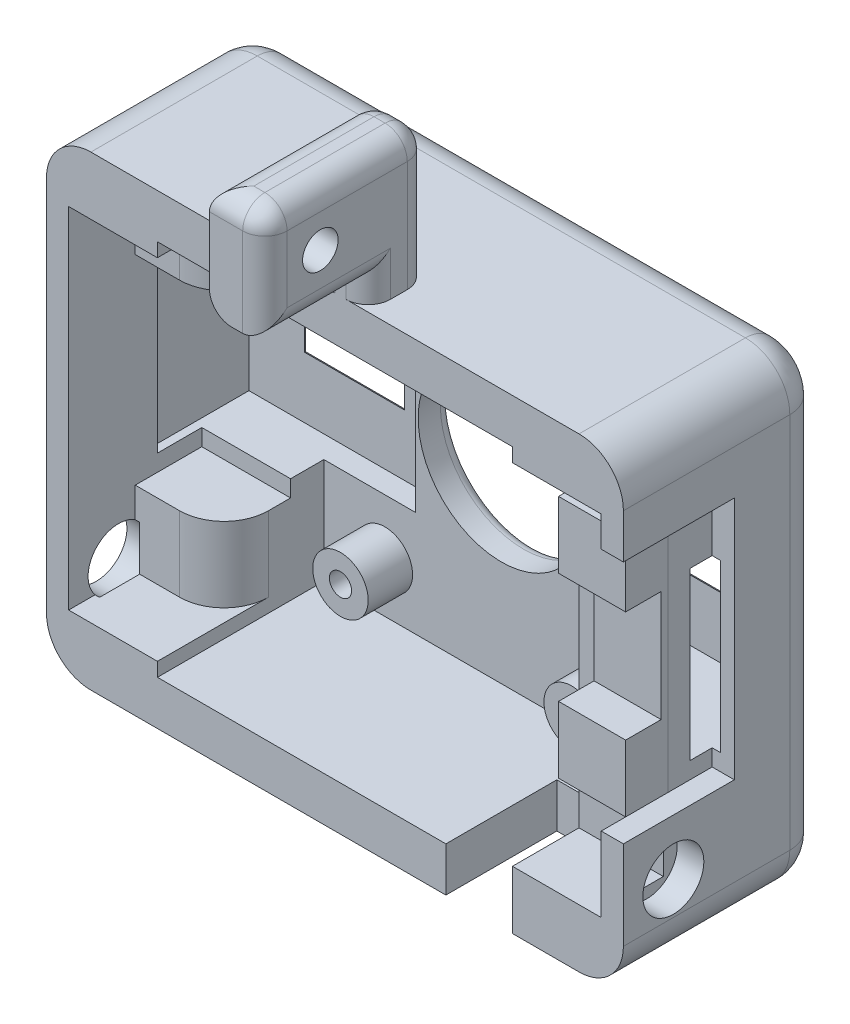
from build123d import *

# Parameters (mm, degrees)
SKETCH1_W               = 52
SKETCH1_H               = 42
BOSS_EXTRUDE1_DEPTH     = 10
SKETCH2_W               = 48
SKETCH2_H               = 31.5
CUT_EXTRUDE1_DEPTH      = 6
SKETCH6_W               = 52
SKETCH6_H               = 42
BOSS_EXTRUDE2_DEPTH     = 8
CUT_EXTRUDE5_DEPTH      = 36.510561809
CUT_EXTRUDE5_DEPTH_BACK = 9
SKETCH5_W               = 32
SKETCH5_H               = 34
CUT_EXTRUDE4_REACH      = 38.633
SKETCH7_R               = 7.5
FILLET2_R               = 1
FILLET3_R               = 3
FILLET4_R               = 4
SKETCH8_W               = 2
SKETCH8_H               = 22
CUT_EXTRUDE6_DEPTH      = 10
SKETCH11_W              = 6.046016102
SKETCH11_H              = 22
BOSS_EXTRUDE9_DEPTH     = 3.8
SKETCH12_W              = 7.5
SKETCH12_H              = 10
CUT_EXTRUDE8_DEPTH      = 3.2
FILLET9_R               = 4
SKETCH13_R              = 2.75
CUT_EXTRUDE9_DEPTH      = 2.4
CUT_EXTRUDE10_START     = -2.4
SKETCH14_R              = 2.75
CUT_EXTRUDE10_DEPTH     = 2.4
SKETCH18_W              = 17
SKETCH18_H              = 15
CUT_EXTRUDE15_DEPTH     = 9
SKETCH19_W              = 9
SKETCH19_H              = 4
CUT_EXTRUDE16_DEPTH     = 1
SKETCH21_W              = 5
SKETCH21_H              = 5.520077182
BOSS_EXTRUDE10_DEPTH    = 2
SKETCH27_W              = 5
SKETCH27_H              = 14.834345629
BOSS_EXTRUDE13_DEPTH    = 10
SKETCH28_R              = 1.6
CUT_EXTRUDE19_DEPTH     = 48.392414643
FILLET14_R              = 2
FILLET13_R              = 2
SKETCH25_R              = 2.5
BOSS_EXTRUDE12_DEPTH    = 4
SKETCH26_R              = 1
CUT_EXTRUDE18_DEPTH     = 4
SKETCH29_W              = 8
SKETCH29_H              = 18
CUT_EXTRUDE20_DEPTH     = 6
SKETCH30_W              = 28
SKETCH30_H              = 9
CUT_EXTRUDE21_DEPTH     = 2
CHAMFER1_SIZE           = 1
SKETCH31_W              = 6
SKETCH31_H              = 4
CUT_EXTRUDE22_DEPTH     = 10


with BuildPart() as part:
    # Sketch1 → Boss-Extrude1 (new body)
    with BuildSketch(Plane.XY):
        Rectangle(SKETCH1_W, SKETCH1_H)
    extrude(amount=BOSS_EXTRUDE1_DEPTH)

    # Sketch2 → Cut-Extrude1 (cut)
    with BuildSketch(Plane.XY.offset(10)):
        Rectangle(SKETCH2_W, SKETCH2_H)
    extrude(amount=-CUT_EXTRUDE1_DEPTH, mode=Mode.SUBTRACT)

    # Sketch6 → Boss-Extrude2 (add)
    with BuildSketch(Plane(origin=(0, 0, 0), x_dir=(-1, 0, 0), z_dir=(0, 0, -1))):
        Rectangle(SKETCH6_W, SKETCH6_H)
    extrude(amount=BOSS_EXTRUDE2_DEPTH)

    # Sketch5 → Cut-Extrude5 (cut, two sides: drawn at the far end of the back side and taken through both)
    with BuildSketch(Plane.XY.offset(4).offset(-CUT_EXTRUDE5_DEPTH_BACK)):
        Rectangle(SKETCH5_W, SKETCH5_H)
    extrude(amount=CUT_EXTRUDE5_DEPTH + CUT_EXTRUDE5_DEPTH_BACK, mode=Mode.SUBTRACT)

    # Sketch7 → Cut-Extrude4 (cut, up to next)
    with BuildSketch(Plane.XY.offset(-5), mode=Mode.PRIVATE) as cut_extrude4_sk1:
        Circle(SKETCH7_R)
    cut_extrude4_tool1 = extrude(cut_extrude4_sk1.sketch, amount=-CUT_EXTRUDE4_REACH, mode=Mode.PRIVATE) & part.part
    add(cut_extrude4_tool1.solids().sort_by_distance((0, 0, -5))[0], mode=Mode.SUBTRACT)

    # Fillet2
    fillet2_edges = [part.edges().sort_by_distance(p)[0] for p in [
        (-7.5, 0, -8),
    ]]
    fillet(fillet2_edges, radius=FILLET2_R)

    # Fillet3
    fillet3_edges = [part.edges().sort_by_distance(p)[0] for p in [
        (-26, 0, -8),
        (0, 21, -8),
        (26, 0, -8),
        (0, -21, -8),
    ]]
    fillet(fillet3_edges, radius=FILLET3_R)

    # Fillet4
    # the kernel refuses this fillet: 4 mm, written as the material it takes off along each edge
    with BuildSketch(Plane(origin=(22, 17, -8), x_dir=(0, 1, 0), z_dir=(-1, 0, 0))) as fillet4_piece_1:
        with BuildLine():
            CenterArc((1, -3), 3, 0, 90)
            Line((4, -3), (4, 0))
            Line((4, 0), (1, 0))
        make_face()
    revolve(axis=Axis((22, 17, -8), (0, 0, -1)), revolution_arc=90, mode=Mode.SUBTRACT)
    with BuildSketch(Plane(origin=(-22, 17, -8), x_dir=(-1, 0, 0), z_dir=(0, -1, 0))) as fillet4_piece_2:
        with BuildLine():
            CenterArc((1, -3), 3, 0, 90)
            Line((4, -3), (4, 0))
            Line((4, 0), (1, 0))
        make_face()
    revolve(axis=Axis((-22, 17, -8), (0, 0, -1)), revolution_arc=90, mode=Mode.SUBTRACT)
    with BuildSketch(Plane(origin=(22, -17, -8), x_dir=(1, 0, 0), z_dir=(0, 1, 0))) as fillet4_piece_3:
        with BuildLine():
            CenterArc((1, -3), 3, 0, 90)
            Line((4, -3), (4, 0))
            Line((4, 0), (1, 0))
        make_face()
    revolve(axis=Axis((22, -17, -8), (0, 0, -1)), revolution_arc=90, mode=Mode.SUBTRACT)
    with BuildSketch(Plane(origin=(-22, -17, -8), x_dir=(0, -1, 0), z_dir=(1, 0, 0))) as fillet4_piece_4:
        with BuildLine():
            CenterArc((1, -3), 3, 0, 90)
            Line((4, -3), (4, 0))
            Line((4, 0), (1, 0))
        make_face()
    revolve(axis=Axis((-22, -17, -8), (0, 0, -1)), revolution_arc=90, mode=Mode.SUBTRACT)
    with BuildSketch(Plane(origin=(-26, 21, -8), x_dir=(0, -1, 0), z_dir=(0, 0, 1)), Plane(origin=(26, -21, 20), x_dir=(-1, 0, 0), z_dir=(0, 0, -1))) as fillet4_piece_5:
        with BuildLine():
            CenterArc((FILLET4_R, FILLET4_R), FILLET4_R, 180, 90)
            Line((0, FILLET4_R), (0, 0))
            Line((0, 0), (FILLET4_R, 0))
        make_face()
    extrude(amount=28, mode=Mode.SUBTRACT)
    with BuildSketch(Plane(origin=(-26, -21, -8), x_dir=(0, 1, 0), z_dir=(0, 0, 1)), Plane(origin=(26, 21, 20), x_dir=(-1, 0, 0), z_dir=(0, 0, -1))) as fillet4_piece_6:
        with BuildLine():
            CenterArc((FILLET4_R, -FILLET4_R), FILLET4_R, 90, 90)
            Line((0, -FILLET4_R), (0, 0))
            Line((0, 0), (FILLET4_R, 0))
        make_face()
    extrude(amount=28, mode=Mode.SUBTRACT)

    # Sketch8 → Cut-Extrude6 (cut)
    with BuildSketch(Plane.XY.offset(10)):
        with Locations((25, 2)):
            Rectangle(SKETCH8_W, SKETCH8_H)
    extrude(amount=-CUT_EXTRUDE6_DEPTH, mode=Mode.SUBTRACT)

    # Fillet9
    fillet9_edges = [part.edges().sort_by_distance(p)[0] for p in [
        (-16, 0, 4),
    ]]
    fillet(fillet9_edges, radius=FILLET9_R)

    # Sketch13 → Cut-Extrude9 (cut)
    with BuildSketch(Plane(origin=(26, 0, 0), x_dir=(0, 0, -1), z_dir=(1, 0, 0))):
        with Locations(Location((-5.5, -14, 0), (0, 0, 90))):
            Circle(SKETCH13_R)
    extrude(amount=-CUT_EXTRUDE9_DEPTH, mode=Mode.SUBTRACT)

    # Sketch14 → Cut-Extrude10 (cut)
    with BuildSketch(Plane.ZY.offset(26).offset(CUT_EXTRUDE10_START)):
        with Locations(Location((5.5, -14, 0), (0, 0, 90))):
            Circle(SKETCH14_R)
    extrude(amount=CUT_EXTRUDE10_DEPTH, mode=Mode.SUBTRACT)

    # Sketch18 → Cut-Extrude15 (cut)
    with BuildSketch(Plane(origin=(0, 0, 2), x_dir=(-1, 0, 0), z_dir=(0, 0, -1))):
        with Locations((-16.25, 0)):
            Rectangle(SKETCH18_W, SKETCH18_H)
        with Locations((16.25, 0)):
            Rectangle(SKETCH18_W, SKETCH18_H)
    extrude(amount=CUT_EXTRUDE15_DEPTH, mode=Mode.SUBTRACT)

    # Sketch19 → Cut-Extrude16 (cut)
    with BuildSketch(Plane.XY.offset(-7)):
        with Locations((15.25, 0)):
            Rectangle(SKETCH19_W, SKETCH19_H)
        with Locations((-15.25, 0)):
            Rectangle(SKETCH19_W, SKETCH19_H)
    extrude(amount=-CUT_EXTRUDE16_DEPTH, mode=Mode.SUBTRACT)

    # Sketch21 → Boss-Extrude10 (add)
    with BuildSketch(Plane(origin=(0, 21, 0), x_dir=(1, 0, 0), z_dir=(0, 1, 0))):
        with Locations((0.5, -7.239961409)):
            Rectangle(SKETCH21_W, SKETCH21_H)
    extrude(amount=BOSS_EXTRUDE10_DEPTH)

    # Sketch27 → Boss-Extrude13 (add)
    with BuildSketch(Plane(origin=(0, 23, 0), x_dir=(1, 0, 0), z_dir=(0, 1, 0))):
        with Locations((0.5, -11.897095633)):
            Rectangle(SKETCH27_W, SKETCH27_H)
    extrude(amount=BOSS_EXTRUDE13_DEPTH)

    # Sketch28 → Cut-Extrude19 (cut, through all)
    with BuildSketch(Plane.ZY.offset(2)):
        with Locations((14.314268447, 28)):
            Circle(SKETCH28_R)
    extrude(amount=-CUT_EXTRUDE19_DEPTH, mode=Mode.SUBTRACT)

    # Fillet14
    fillet14_edges = [part.edges().sort_by_distance(p)[0] for p in [
        (-2, 27, 4.479922818),
        (-2, 22, 10),
        (3, 22, 10),
        (3, 27, 4.479922818),
        (-2, 23, 14.657134224),
        (3, 23, 14.657134224),
        (3, 28, 19.314268447),
        (-2, 33, 11.897095633),
        (0.5, 33, 19.314268447),
        (3, 33, 11.897095633),
        (0.5, 33, 4.479922818),
    ]]
    fillet(fillet14_edges, radius=FILLET14_R)

    # Fillet13
    # the kernel refuses this fillet: 2 mm, written as the material it takes off along each edge
    with BuildSketch(Plane(origin=(-19.75, -2, -8), x_dir=(-1, 0, 0), z_dir=(0, 1, 0)), Plane(origin=(-10.75, 2, -8), x_dir=(1, 0, 0), z_dir=(0, -1, 0)), Plane(origin=(10.75, -2, -8), x_dir=(-1, 0, 0), z_dir=(0, 1, 0)), Plane(origin=(19.75, 2, -8), x_dir=(1, 0, 0), z_dir=(0, -1, 0))) as fillet13_piece_1:
        with BuildLine():
            CenterArc((1.732050808, 2), FILLET13_R, 210, 60)
            Line((0, 1), (-0.034641016, 0.98))
            ThreePointArc((-0.034641016, 0.98), (-0.04, 0.5), (-0.04, 0))
            Line((-0.04, 0), (0, -0.04))
            Line((0, -0.04), (1.732050808, -0.04))
            Line((1.732050808, -0.04), (1.732050808, 0))
        make_face()
    extrude(amount=4, mode=Mode.SUBTRACT)
    with BuildSketch(Plane(origin=(-10.75, -2, -8), x_dir=(0, -1, 0), z_dir=(-1, 0, 0)), Plane(origin=(-19.75, 2, -8), x_dir=(0, 1, 0), z_dir=(1, 0, 0)), Plane(origin=(19.75, -2, -8), x_dir=(0, -1, 0), z_dir=(-1, 0, 0)), Plane(origin=(10.75, 2, -8), x_dir=(0, 1, 0), z_dir=(1, 0, 0))) as fillet13_piece_2:
        with BuildLine():
            CenterArc((1.732050808, 2), FILLET13_R, 210, 60)
            Line((0, 1), (-0.034641016, 0.98))
            ThreePointArc((-0.034641016, 0.98), (-0.04, 0.5), (-0.04, 0))
            Line((-0.04, 0), (0, -0.04))
            Line((0, -0.04), (1.732050808, -0.04))
            Line((1.732050808, -0.04), (1.732050808, 0))
        make_face()
    extrude(amount=9, mode=Mode.SUBTRACT)
    with BuildSketch(Plane(origin=(-19.75, -6.330127019, -8), x_dir=(-1, 0, 0), z_dir=(0, 1, 0))) as fillet13_piece_3a_section:
        with BuildLine():
            CenterArc((1.732050808, 2), FILLET13_R, 210, 60)
            Line((0, 1), (-0.034641016, 0.98))
            ThreePointArc((-0.034641016, 0.98), (-0.04, 0.5), (-0.04, 0))
            Line((-0.04, 0), (0, -0.04))
            Line((0, -0.04), (1.732050808, -0.04))
            Line((1.732050808, -0.04), (1.732050808, 0))
        make_face()
    fillet13_piece_3a = extrude(amount=8.330127019, mode=Mode.PRIVATE)
    fillet13_piece_3a = split(fillet13_piece_3a, bisect_by=Plane(origin=(-20.182620892, -2, -7.740966578), z_dir=(0, -1, 0)), keep=Keep.TOP, mode=Mode.PRIVATE)
    with BuildSketch(Plane(origin=(-10.75, -2, -8), x_dir=(0, -1, 0), z_dir=(-1, 0, 0))) as fillet13_piece_3b_section:
        with BuildLine():
            CenterArc((1.732050808, 2), FILLET13_R, 210, 60)
            Line((0, 1), (-0.034641016, 0.98))
            ThreePointArc((-0.034641016, 0.98), (-0.04, 0.5), (-0.04, 0))
            Line((-0.04, 0), (0, -0.04))
            Line((0, -0.04), (1.732050808, -0.04))
            Line((1.732050808, -0.04), (1.732050808, 0))
        make_face()
    fillet13_piece_3b = extrude(amount=13.330127019, mode=Mode.PRIVATE)
    fillet13_piece_3b = split(fillet13_piece_3b, bisect_by=Plane(origin=(-19.75, -2.432620892, -7.740966578), z_dir=(-1, 0, 0)), keep=Keep.TOP, mode=Mode.PRIVATE)
    fillet13_piece_3 = fillet13_piece_3a & fillet13_piece_3b
    add(fillet13_piece_3, mode=Mode.SUBTRACT)
    with BuildSketch(Plane(origin=(-19.75, -2, -8), x_dir=(-1, 0, 0), z_dir=(0, 1, 0))) as fillet13_piece_4a_section:
        with BuildLine():
            CenterArc((1.732050808, 2), FILLET13_R, 210, 60)
            Line((0, 1), (-0.034641016, 0.98))
            ThreePointArc((-0.034641016, 0.98), (-0.04, 0.5), (-0.04, 0))
            Line((-0.04, 0), (0, -0.04))
            Line((0, -0.04), (1.732050808, -0.04))
            Line((1.732050808, -0.04), (1.732050808, 0))
        make_face()
    fillet13_piece_4a = extrude(amount=8.330127019, mode=Mode.PRIVATE)
    fillet13_piece_4a = split(fillet13_piece_4a, bisect_by=Plane(origin=(-20.182620892, 2, -7.740966578), z_dir=(0, 1, 0)), keep=Keep.TOP, mode=Mode.PRIVATE)
    with BuildSketch(Plane(origin=(-24.080127019, 2, -8), x_dir=(0, 1, 0), z_dir=(1, 0, 0))) as fillet13_piece_4b_section:
        with BuildLine():
            CenterArc((1.732050808, 2), FILLET13_R, 210, 60)
            Line((0, 1), (-0.034641016, 0.98))
            ThreePointArc((-0.034641016, 0.98), (-0.04, 0.5), (-0.04, 0))
            Line((-0.04, 0), (0, -0.04))
            Line((0, -0.04), (1.732050808, -0.04))
            Line((1.732050808, -0.04), (1.732050808, 0))
        make_face()
    fillet13_piece_4b = extrude(amount=13.330127019, mode=Mode.PRIVATE)
    fillet13_piece_4b = split(fillet13_piece_4b, bisect_by=Plane(origin=(-19.75, 2.432620892, -7.740966578), z_dir=(-1, 0, 0)), keep=Keep.TOP, mode=Mode.PRIVATE)
    fillet13_piece_4 = fillet13_piece_4a & fillet13_piece_4b
    add(fillet13_piece_4, mode=Mode.SUBTRACT)
    with BuildSketch(Plane(origin=(-10.75, 6.330127019, -8), x_dir=(1, 0, 0), z_dir=(0, -1, 0))) as fillet13_piece_5a_section:
        with BuildLine():
            CenterArc((1.732050808, 2), FILLET13_R, 210, 60)
            Line((0, 1), (-0.034641016, 0.98))
            ThreePointArc((-0.034641016, 0.98), (-0.04, 0.5), (-0.04, 0))
            Line((-0.04, 0), (0, -0.04))
            Line((0, -0.04), (1.732050808, -0.04))
            Line((1.732050808, -0.04), (1.732050808, 0))
        make_face()
    fillet13_piece_5a = extrude(amount=8.330127019, mode=Mode.PRIVATE)
    fillet13_piece_5a = split(fillet13_piece_5a, bisect_by=Plane(origin=(-10.317379108, 2, -7.740966578), z_dir=(0, 1, 0)), keep=Keep.TOP, mode=Mode.PRIVATE)
    with BuildSketch(Plane(origin=(-19.75, 2, -8), x_dir=(0, 1, 0), z_dir=(1, 0, 0))) as fillet13_piece_5b_section:
        with BuildLine():
            CenterArc((1.732050808, 2), FILLET13_R, 210, 60)
            Line((0, 1), (-0.034641016, 0.98))
            ThreePointArc((-0.034641016, 0.98), (-0.04, 0.5), (-0.04, 0))
            Line((-0.04, 0), (0, -0.04))
            Line((0, -0.04), (1.732050808, -0.04))
            Line((1.732050808, -0.04), (1.732050808, 0))
        make_face()
    fillet13_piece_5b = extrude(amount=13.330127019, mode=Mode.PRIVATE)
    fillet13_piece_5b = split(fillet13_piece_5b, bisect_by=Plane(origin=(-10.75, 2.432620892, -7.740966578), z_dir=(1, 0, 0)), keep=Keep.TOP, mode=Mode.PRIVATE)
    fillet13_piece_5 = fillet13_piece_5a & fillet13_piece_5b
    add(fillet13_piece_5, mode=Mode.SUBTRACT)
    with BuildSketch(Plane(origin=(-6.419872981, -2, -8), x_dir=(0, -1, 0), z_dir=(-1, 0, 0))) as fillet13_piece_6a_section:
        with BuildLine():
            CenterArc((1.732050808, 2), FILLET13_R, 210, 60)
            Line((0, 1), (-0.034641016, 0.98))
            ThreePointArc((-0.034641016, 0.98), (-0.04, 0.5), (-0.04, 0))
            Line((-0.04, 0), (0, -0.04))
            Line((0, -0.04), (1.732050808, -0.04))
            Line((1.732050808, -0.04), (1.732050808, 0))
        make_face()
    fillet13_piece_6a = extrude(amount=13.330127019, mode=Mode.PRIVATE)
    fillet13_piece_6a = split(fillet13_piece_6a, bisect_by=Plane(origin=(-10.75, -2.432620892, -7.740966578), z_dir=(1, 0, 0)), keep=Keep.TOP, mode=Mode.PRIVATE)
    with BuildSketch(Plane(origin=(-10.75, 2, -8), x_dir=(1, 0, 0), z_dir=(0, -1, 0))) as fillet13_piece_6b_section:
        with BuildLine():
            CenterArc((1.732050808, 2), FILLET13_R, 210, 60)
            Line((0, 1), (-0.034641016, 0.98))
            ThreePointArc((-0.034641016, 0.98), (-0.04, 0.5), (-0.04, 0))
            Line((-0.04, 0), (0, -0.04))
            Line((0, -0.04), (1.732050808, -0.04))
            Line((1.732050808, -0.04), (1.732050808, 0))
        make_face()
    fillet13_piece_6b = extrude(amount=8.330127019, mode=Mode.PRIVATE)
    fillet13_piece_6b = split(fillet13_piece_6b, bisect_by=Plane(origin=(-10.317379108, -2, -7.740966578), z_dir=(0, -1, 0)), keep=Keep.TOP, mode=Mode.PRIVATE)
    fillet13_piece_6 = fillet13_piece_6a & fillet13_piece_6b
    add(fillet13_piece_6, mode=Mode.SUBTRACT)
    with BuildSketch(Plane(origin=(10.75, -6.330127019, -8), x_dir=(-1, 0, 0), z_dir=(0, 1, 0))) as fillet13_piece_7a_section:
        with BuildLine():
            CenterArc((1.732050808, 2), FILLET13_R, 210, 60)
            Line((0, 1), (-0.034641016, 0.98))
            ThreePointArc((-0.034641016, 0.98), (-0.04, 0.5), (-0.04, 0))
            Line((-0.04, 0), (0, -0.04))
            Line((0, -0.04), (1.732050808, -0.04))
            Line((1.732050808, -0.04), (1.732050808, 0))
        make_face()
    fillet13_piece_7a = extrude(amount=8.330127019, mode=Mode.PRIVATE)
    fillet13_piece_7a = split(fillet13_piece_7a, bisect_by=Plane(origin=(10.317379108, -2, -7.740966578), z_dir=(0, -1, 0)), keep=Keep.TOP, mode=Mode.PRIVATE)
    with BuildSketch(Plane(origin=(19.75, -2, -8), x_dir=(0, -1, 0), z_dir=(-1, 0, 0))) as fillet13_piece_7b_section:
        with BuildLine():
            CenterArc((1.732050808, 2), FILLET13_R, 210, 60)
            Line((0, 1), (-0.034641016, 0.98))
            ThreePointArc((-0.034641016, 0.98), (-0.04, 0.5), (-0.04, 0))
            Line((-0.04, 0), (0, -0.04))
            Line((0, -0.04), (1.732050808, -0.04))
            Line((1.732050808, -0.04), (1.732050808, 0))
        make_face()
    fillet13_piece_7b = extrude(amount=13.330127019, mode=Mode.PRIVATE)
    fillet13_piece_7b = split(fillet13_piece_7b, bisect_by=Plane(origin=(10.75, -2.432620892, -7.740966578), z_dir=(-1, 0, 0)), keep=Keep.TOP, mode=Mode.PRIVATE)
    fillet13_piece_7 = fillet13_piece_7a & fillet13_piece_7b
    add(fillet13_piece_7, mode=Mode.SUBTRACT)
    with BuildSketch(Plane(origin=(10.75, -2, -8), x_dir=(-1, 0, 0), z_dir=(0, 1, 0))) as fillet13_piece_8a_section:
        with BuildLine():
            CenterArc((1.732050808, 2), FILLET13_R, 210, 60)
            Line((0, 1), (-0.034641016, 0.98))
            ThreePointArc((-0.034641016, 0.98), (-0.04, 0.5), (-0.04, 0))
            Line((-0.04, 0), (0, -0.04))
            Line((0, -0.04), (1.732050808, -0.04))
            Line((1.732050808, -0.04), (1.732050808, 0))
        make_face()
    fillet13_piece_8a = extrude(amount=8.330127019, mode=Mode.PRIVATE)
    fillet13_piece_8a = split(fillet13_piece_8a, bisect_by=Plane(origin=(10.317379108, 2, -7.740966578), z_dir=(0, 1, 0)), keep=Keep.TOP, mode=Mode.PRIVATE)
    with BuildSketch(Plane(origin=(6.419872981, 2, -8), x_dir=(0, 1, 0), z_dir=(1, 0, 0))) as fillet13_piece_8b_section:
        with BuildLine():
            CenterArc((1.732050808, 2), FILLET13_R, 210, 60)
            Line((0, 1), (-0.034641016, 0.98))
            ThreePointArc((-0.034641016, 0.98), (-0.04, 0.5), (-0.04, 0))
            Line((-0.04, 0), (0, -0.04))
            Line((0, -0.04), (1.732050808, -0.04))
            Line((1.732050808, -0.04), (1.732050808, 0))
        make_face()
    fillet13_piece_8b = extrude(amount=13.330127019, mode=Mode.PRIVATE)
    fillet13_piece_8b = split(fillet13_piece_8b, bisect_by=Plane(origin=(10.75, 2.432620892, -7.740966578), z_dir=(-1, 0, 0)), keep=Keep.TOP, mode=Mode.PRIVATE)
    fillet13_piece_8 = fillet13_piece_8a & fillet13_piece_8b
    add(fillet13_piece_8, mode=Mode.SUBTRACT)
    with BuildSketch(Plane(origin=(19.75, 6.330127019, -8), x_dir=(1, 0, 0), z_dir=(0, -1, 0))) as fillet13_piece_9a_section:
        with BuildLine():
            CenterArc((1.732050808, 2), FILLET13_R, 210, 60)
            Line((0, 1), (-0.034641016, 0.98))
            ThreePointArc((-0.034641016, 0.98), (-0.04, 0.5), (-0.04, 0))
            Line((-0.04, 0), (0, -0.04))
            Line((0, -0.04), (1.732050808, -0.04))
            Line((1.732050808, -0.04), (1.732050808, 0))
        make_face()
    fillet13_piece_9a = extrude(amount=8.330127019, mode=Mode.PRIVATE)
    fillet13_piece_9a = split(fillet13_piece_9a, bisect_by=Plane(origin=(20.182620892, 2, -7.740966578), z_dir=(0, 1, 0)), keep=Keep.TOP, mode=Mode.PRIVATE)
    with BuildSketch(Plane(origin=(10.75, 2, -8), x_dir=(0, 1, 0), z_dir=(1, 0, 0))) as fillet13_piece_9b_section:
        with BuildLine():
            CenterArc((1.732050808, 2), FILLET13_R, 210, 60)
            Line((0, 1), (-0.034641016, 0.98))
            ThreePointArc((-0.034641016, 0.98), (-0.04, 0.5), (-0.04, 0))
            Line((-0.04, 0), (0, -0.04))
            Line((0, -0.04), (1.732050808, -0.04))
            Line((1.732050808, -0.04), (1.732050808, 0))
        make_face()
    fillet13_piece_9b = extrude(amount=13.330127019, mode=Mode.PRIVATE)
    fillet13_piece_9b = split(fillet13_piece_9b, bisect_by=Plane(origin=(19.75, 2.432620892, -7.740966578), z_dir=(1, 0, 0)), keep=Keep.TOP, mode=Mode.PRIVATE)
    fillet13_piece_9 = fillet13_piece_9a & fillet13_piece_9b
    add(fillet13_piece_9, mode=Mode.SUBTRACT)
    with BuildSketch(Plane(origin=(24.080127019, -2, -8), x_dir=(0, -1, 0), z_dir=(-1, 0, 0))) as fillet13_piece_10a_section:
        with BuildLine():
            CenterArc((1.732050808, 2), FILLET13_R, 210, 60)
            Line((0, 1), (-0.034641016, 0.98))
            ThreePointArc((-0.034641016, 0.98), (-0.04, 0.5), (-0.04, 0))
            Line((-0.04, 0), (0, -0.04))
            Line((0, -0.04), (1.732050808, -0.04))
            Line((1.732050808, -0.04), (1.732050808, 0))
        make_face()
    fillet13_piece_10a = extrude(amount=13.330127019, mode=Mode.PRIVATE)
    fillet13_piece_10a = split(fillet13_piece_10a, bisect_by=Plane(origin=(19.75, -2.432620892, -7.740966578), z_dir=(1, 0, 0)), keep=Keep.TOP, mode=Mode.PRIVATE)
    with BuildSketch(Plane(origin=(19.75, 2, -8), x_dir=(1, 0, 0), z_dir=(0, -1, 0))) as fillet13_piece_10b_section:
        with BuildLine():
            CenterArc((1.732050808, 2), FILLET13_R, 210, 60)
            Line((0, 1), (-0.034641016, 0.98))
            ThreePointArc((-0.034641016, 0.98), (-0.04, 0.5), (-0.04, 0))
            Line((-0.04, 0), (0, -0.04))
            Line((0, -0.04), (1.732050808, -0.04))
            Line((1.732050808, -0.04), (1.732050808, 0))
        make_face()
    fillet13_piece_10b = extrude(amount=8.330127019, mode=Mode.PRIVATE)
    fillet13_piece_10b = split(fillet13_piece_10b, bisect_by=Plane(origin=(20.182620892, -2, -7.740966578), z_dir=(0, -1, 0)), keep=Keep.TOP, mode=Mode.PRIVATE)
    fillet13_piece_10 = fillet13_piece_10a & fillet13_piece_10b
    add(fillet13_piece_10, mode=Mode.SUBTRACT)

    # Sketch25 → Boss-Extrude12 (add)
    with BuildSketch(Plane.XY.offset(-5)):
        with Locations((-10.5, 12.5)):
            Circle(SKETCH25_R)
        with Locations((10.5, 12.5)):
            Circle(SKETCH25_R)
        with Locations((-10.5, -12.5)):
            Circle(SKETCH25_R)
        with Locations((10.337570801, -12.5)):
            Circle(SKETCH25_R)
    extrude(amount=BOSS_EXTRUDE12_DEPTH)

    # Sketch26 → Cut-Extrude18 (cut)
    with BuildSketch(Plane.XY.offset(-1)):
        with Locations((-10.5, 12.5)):
            Circle(SKETCH26_R)
        with Locations((10.5, 12.5)):
            Circle(SKETCH26_R)
        with Locations((-10.5, -12.5)):
            Circle(SKETCH26_R)
        with Locations((10.337570801, -12.5)):
            Circle(SKETCH26_R)
    extrude(amount=-CUT_EXTRUDE18_DEPTH, mode=Mode.SUBTRACT)

    # Sketch29 → Cut-Extrude20 (cut)
    with BuildSketch(Plane.XY.offset(4)):
        with Locations((-20, 0)):
            Rectangle(SKETCH29_W, SKETCH29_H)
    extrude(amount=-CUT_EXTRUDE20_DEPTH, mode=Mode.SUBTRACT)

    # Sketch30 → Cut-Extrude21 (cut)
    with BuildSketch(Plane.XZ.offset(-17)):
        with Locations((0, -0.436114316)):
            Rectangle(SKETCH30_W, SKETCH30_H)
    extrude(amount=-CUT_EXTRUDE21_DEPTH, mode=Mode.SUBTRACT)

    # Chamfer1
    chamfer1_edges = [part.edges().sort_by_distance(p)[0] for p in [
        (-14, 17, -0.436114316),
        (14, 17, -0.436114316),
    ]]
    chamfer(chamfer1_edges, length=CHAMFER1_SIZE)

    # Sketch31 → Cut-Extrude22 (cut)
    with BuildSketch(Plane.XY.offset(10)):
        with Locations((13, -19)):
            Rectangle(SKETCH31_W, SKETCH31_H)
    extrude(amount=-CUT_EXTRUDE22_DEPTH, mode=Mode.SUBTRACT)


with BuildPart() as body_2:
    # Sketch11 → Boss-Extrude9 (new body)
    with BuildSketch(Plane.XY.offset(4)):
        with Locations((20.976991949, 2)):
            Rectangle(SKETCH11_W, SKETCH11_H)
    extrude(amount=BOSS_EXTRUDE9_DEPTH)

    # Sketch12 → Cut-Extrude8 (cut)
    with BuildSketch(Plane.XY.offset(7.8)):
        with Locations((20.25, 2)):
            Rectangle(SKETCH12_W, SKETCH12_H)
    extrude(amount=-CUT_EXTRUDE8_DEPTH, mode=Mode.SUBTRACT)


solid = Compound([part.part, body_2.part])
